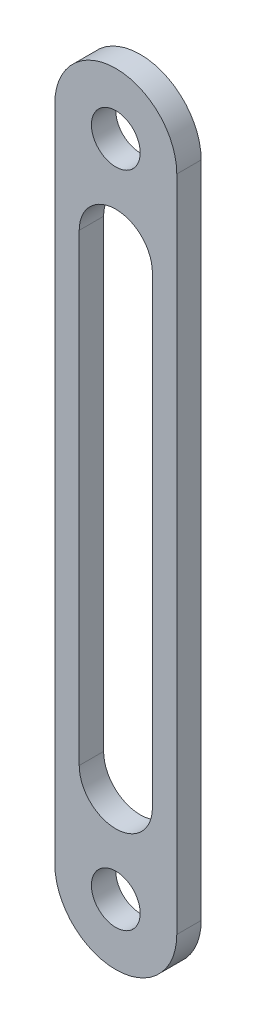
from build123d import *

# Parameters (mm, degrees)
CROQUIS1_R              = 4
SALIENTE_EXTRUIR1_DEPTH = 4


with BuildPart() as part:
    # Croquis1 → Saliente-Extruir1 (new body)
    with BuildSketch(Plane.XY):
        with BuildLine():
            Line((10, 54), (10, -54))
            ThreePointArc((10, -54), (0, -64), (-10, -54))
            Line((-10, -54), (-10, 54))
            ThreePointArc((-10, 54), (0, 64), (10, 54))
        make_face()
        with Locations((0, 54)):
            Circle(CROQUIS1_R, mode=Mode.SUBTRACT)
        with Locations((0, -54)):
            Circle(CROQUIS1_R, mode=Mode.SUBTRACT)
        with BuildLine():
            Line((6, 38), (6, -38))
            ThreePointArc((6, -38), (0, -44), (-6, -38))
            Line((-6, -38), (-6, 38))
            ThreePointArc((-6, 38), (0, 44), (6, 38))
        make_face(mode=Mode.SUBTRACT)
    extrude(amount=SALIENTE_EXTRUIR1_DEPTH)


solid = part.part
